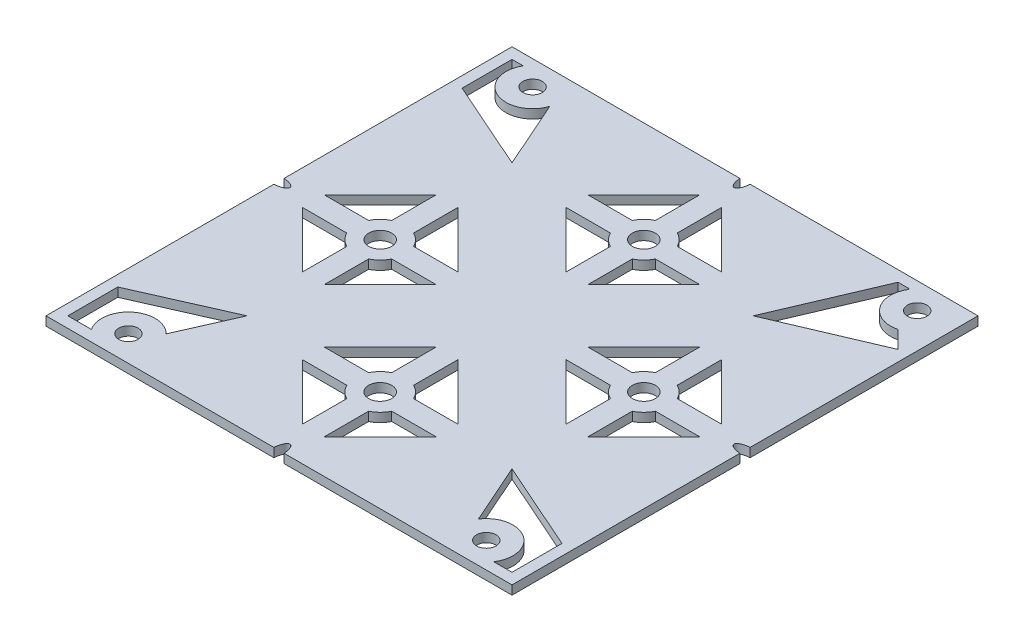
from build123d import *

# Parameters (mm, degrees)
SKETCH1_W           = 97.6
SKETCH1_H           = 97.6
BOSS_EXTRUDE1_DEPTH = 1.85
SKETCH3_R           = 1.25
CUT_EXTRUDE1_DEPTH  = 10
FILLET1_R           = 0.2
SKETCH5_R           = 2.375
CUT_EXTRUDE2_DEPTH  = 10
SKETCH6_R           = 2
CUT_EXTRUDE3_DEPTH  = 139.039641188
SKETCH7_W           = 97.6
SKETCH7_H           = 1.85
CUT_EXTRUDE4_DEPTH  = 0.75
SKETCH8_W           = 96.85
SKETCH8_H           = 1.85
CUT_EXTRUDE5_DEPTH  = 0.75
SKETCH9_W           = 96.85
SKETCH9_H           = 1.85
CUT_EXTRUDE6_DEPTH  = 0.75
SKETCH12_W          = 96.1
SKETCH12_H          = 1.85
CUT_EXTRUDE7_DEPTH  = 0.75


with BuildPart() as part:
    # Sketch1 → Boss-Extrude1 (new body)
    with BuildSketch(Plane(origin=(0, 0, 0), x_dir=(1, 0, 0), z_dir=(0, 1, 0))):
        with Locations((48.8, 48.8)):
            Rectangle(SKETCH1_W, SKETCH1_H)
    extrude(amount=BOSS_EXTRUDE1_DEPTH)

    # Sketch3 → Cut-Extrude1 (cut)
    with BuildSketch(Plane.XZ):
        with BuildLine():
            Line((3, -84.3), (3, -94.6))
            Line((3, -94.6), (5.316079849, -94.6))
            ThreePointArc((5.316079849, -94.6), (7.792729855, -86.784550719), (15.285000001, -90.113353923))
            Line((15.285000001, -90.113353923), (21.472818771, -76.127181229))
            Line((21.472818771, -76.127181229), (3, -84.3))
        make_face()
        with BuildLine():
            Line((3, -13.3), (21.472818771, -21.472818771))
            Line((21.472818771, -21.472818771), (16.360495139, -9.917560959))
            ThreePointArc((16.360495139, -9.917560959), (8.975209709, -10.313312378), (7.873156109, -3))
            Line((7.873156109, -3), (3, -3))
            Line((3, -3), (3, -13.3))
        make_face()
        with BuildLine():
            Line((94.6, -13.3), (94.6, -3))
            Line((94.6, -3), (90.826843891, -3))
            ThreePointArc((90.826843891, -3), (89.267333256, -10.648445392), (81.630186258, -9.034513526))
            Line((81.630186258, -9.034513526), (76.127181229, -21.472818771))
            Line((76.127181229, -21.472818771), (94.6, -13.3))
        make_face()
        with BuildLine():
            Line((91.027327292, -86.172672708), (94.6, -82.6))
            Line((94.6, -82.6), (73.674141566, -73.674141566))
            Line((73.674141566, -73.674141566), (82.6, -94.6))
            Line((82.6, -94.6), (85.116873323, -94.6))
            ThreePointArc((85.116873323, -94.6), (85.157069093, -88.341897208), (91.027327292, -86.172672708))
        make_face()
        with Locations((89.66, -91.5)):
            Circle(SKETCH3_R)
        with Locations((10.05, -91.8)):
            Circle(SKETCH3_R)
        with Locations((12.45, -6.05)):
            Circle(SKETCH3_R)
        with Locations((86.25, -6.05)):
            Circle(SKETCH3_R)
    extrude(amount=-CUT_EXTRUDE1_DEPTH, mode=Mode.SUBTRACT)

    # Fillet1
    fillet1_edges = [part.edges().sort_by_distance(p)[0] for p in [
        (85.116873323, 0.925, -94.6),
    ]]
    fillet(fillet1_edges, radius=FILLET1_R)

    # Sketch5 → Cut-Extrude2 (cut)
    with BuildSketch(Plane.XZ):
        with BuildLine():
            Line((51.05, -80.617052601), (51.05, -89.767052601))
            Line((51.05, -89.767052601), (62.582493929, -78.234558673))
            Line((62.582493929, -78.234558673), (53.432493929, -78.234558673))
            ThreePointArc((53.432493929, -78.234558673), (52.441599923, -79.626158596), (51.05, -80.617052601))
        make_face()
        with BuildLine():
            Line((46.55, -89.767052601), (46.55, -80.617052601))
            ThreePointArc((46.55, -80.617052601), (45.158400077, -79.626158596), (44.167506071, -78.234558673))
            Line((44.167506071, -78.234558673), (35.017506071, -78.234558673))
            Line((35.017506071, -78.234558673), (46.55, -89.767052601))
        make_face()
        with BuildLine():
            Line((35.017506071, -73.734558673), (44.167506071, -73.734558673))
            ThreePointArc((44.167506071, -73.734558673), (45.158400077, -72.34295875), (46.55, -71.352064744))
            Line((46.55, -71.352064744), (46.55, -62.202064744))
            Line((46.55, -62.202064744), (35.017506071, -73.734558673))
        make_face()
        with BuildLine():
            ThreePointArc((51.05, -71.352064744), (52.441599923, -72.34295875), (53.432493929, -73.734558673))
            Line((53.432493929, -73.734558673), (62.582493929, -73.734558673))
            Line((62.582493929, -73.734558673), (51.05, -62.202064744))
            Line((51.05, -62.202064744), (51.05, -71.352064744))
        make_face()
        with BuildLine():
            Line((73.734558673, -35.017506071), (62.202064744, -46.55))
            Line((62.202064744, -46.55), (71.352064744, -46.55))
            ThreePointArc((71.352064744, -46.55), (72.34295875, -45.158400077), (73.734558673, -44.167506071))
            Line((73.734558673, -44.167506071), (73.734558673, -35.017506071))
        make_face()
        with BuildLine():
            ThreePointArc((73.734558673, -53.432493929), (72.34295875, -52.441599923), (71.352064744, -51.05))
            Line((71.352064744, -51.05), (62.202064744, -51.05))
            Line((62.202064744, -51.05), (73.734558673, -62.582493929))
            Line((73.734558673, -62.582493929), (73.734558673, -53.432493929))
        make_face()
        with BuildLine():
            Line((78.234558673, -35.017506071), (78.234558673, -44.167506071))
            ThreePointArc((78.234558673, -44.167506071), (79.626158596, -45.158400077), (80.617052601, -46.55))
            Line((80.617052601, -46.55), (89.767052601, -46.55))
            Line((89.767052601, -46.55), (78.234558673, -35.017506071))
        make_face()
        with BuildLine():
            ThreePointArc((80.617052601, -51.05), (79.626158596, -52.441599923), (78.234558673, -53.432493929))
            Line((78.234558673, -53.432493929), (78.234558673, -62.582493929))
            Line((78.234558673, -62.582493929), (89.767052601, -51.05))
            Line((89.767052601, -51.05), (80.617052601, -51.05))
        make_face()
        with BuildLine():
            Line((46.55, -16.982947399), (46.55, -7.832947399))
            Line((46.55, -7.832947399), (35.017506071, -19.365441327))
            Line((35.017506071, -19.365441327), (44.167506071, -19.365441327))
            ThreePointArc((44.167506071, -19.365441327), (45.158400077, -17.973841404), (46.55, -16.982947399))
        make_face()
        with BuildLine():
            Line((51.05, -7.832947399), (51.05, -16.982947399))
            ThreePointArc((51.05, -16.982947399), (52.441599923, -17.973841404), (53.432493929, -19.365441327))
            Line((53.432493929, -19.365441327), (62.582493929, -19.365441327))
            Line((62.582493929, -19.365441327), (51.05, -7.832947399))
        make_face()
        with BuildLine():
            ThreePointArc((46.55, -26.247935256), (45.158400077, -25.25704125), (44.167506071, -23.865441327))
            Line((44.167506071, -23.865441327), (35.017506071, -23.865441327))
            Line((35.017506071, -23.865441327), (46.55, -35.397935256))
            Line((46.55, -35.397935256), (46.55, -26.247935256))
        make_face()
        with BuildLine():
            Line((62.582493929, -23.865441327), (53.432493929, -23.865441327))
            ThreePointArc((53.432493929, -23.865441327), (52.441599923, -25.25704125), (51.05, -26.247935256))
            Line((51.05, -26.247935256), (51.05, -35.397935256))
            Line((51.05, -35.397935256), (62.582493929, -23.865441327))
        make_face()
        with BuildLine():
            Line((23.865441327, -62.582493929), (35.397935256, -51.05))
            Line((35.397935256, -51.05), (26.247935256, -51.05))
            ThreePointArc((26.247935256, -51.05), (25.25704125, -52.441599923), (23.865441327, -53.432493929))
            Line((23.865441327, -53.432493929), (23.865441327, -62.582493929))
        make_face()
        with BuildLine():
            Line((19.365441327, -62.582493929), (19.365441327, -53.432493929))
            ThreePointArc((19.365441327, -53.432493929), (17.973841404, -52.441599923), (16.982947399, -51.05))
            Line((16.982947399, -51.05), (7.832947399, -51.05))
            Line((7.832947399, -51.05), (19.365441327, -62.582493929))
        make_face()
        with BuildLine():
            ThreePointArc((23.865441327, -44.167506071), (25.25704125, -45.158400077), (26.247935256, -46.55))
            Line((26.247935256, -46.55), (35.397935256, -46.55))
            Line((35.397935256, -46.55), (23.865441327, -35.017506071))
            Line((23.865441327, -35.017506071), (23.865441327, -44.167506071))
        make_face()
        with BuildLine():
            Line((7.832947399, -46.55), (16.982947399, -46.55))
            ThreePointArc((16.982947399, -46.55), (17.973841404, -45.158400077), (19.365441327, -44.167506071))
            Line((19.365441327, -44.167506071), (19.365441327, -35.017506071))
            Line((19.365441327, -35.017506071), (7.832947399, -46.55))
        make_face()
        with BuildLine():
            Line((47.7, -97.6), (49.9, -97.6))
            add(Edge.make_bspline(
                [(49.9, -97.6), (49.9, -94.604595373), (48.8, -94.604595373)],
                knots=[4.71238898, 4.71238898, 4.71238898, 6.283185307, 6.283185307, 6.283185307], degree=2, weights=[1, 0.707106781, 1]))
            add(Edge.make_bspline(
                [(48.8, -94.604595373), (47.7, -94.604595373), (47.7, -97.6)],
                knots=[0, 0, 0, 1.570796327, 1.570796327, 1.570796327], degree=2, weights=[1, 0.707106781, 1]))
        make_face()
        with BuildLine():
            add(Edge.make_bspline(
                [(94.596161078, -48.8), (94.596161078, -49.9), (97.6, -49.9)],
                knots=[0, 0, 0, 1.570796327, 1.570796327, 1.570796327], degree=2, weights=[1, 0.707106781, 1]))
            Line((97.6, -49.9), (97.6, -47.7))
            add(Edge.make_bspline(
                [(97.6, -47.7), (94.596161078, -47.7), (94.596161078, -48.8)],
                knots=[4.71238898, 4.71238898, 4.71238898, 6.283185307, 6.283185307, 6.283185307], degree=2, weights=[1, 0.707106781, 1]))
        make_face()
        with BuildLine():
            Line((0, -47.7), (0, -49.9))
            add(Edge.make_bspline(
                [(0, -49.9), (3, -49.9), (3, -48.8)],
                knots=[4.71238898, 4.71238898, 4.71238898, 6.283185307, 6.283185307, 6.283185307], degree=2, weights=[1, 0.707106781, 1]))
            add(Edge.make_bspline(
                [(3, -48.8), (3, -47.7), (0, -47.7)],
                knots=[0, 0, 0, 1.570796327, 1.570796327, 1.570796327], degree=2, weights=[1, 0.707106781, 1]))
        make_face()
        with BuildLine():
            add(Edge.make_bspline(
                [(48.8, -3), (49.9, -3), (49.9, 0)],
                knots=[0, 0, 0, 1.570796327, 1.570796327, 1.570796327], degree=2, weights=[1, 0.707106781, 1]))
            Line((49.9, 0), (47.7, 0))
            add(Edge.make_bspline(
                [(47.7, 0), (47.7, -3), (48.8, -3)],
                knots=[4.71238898, 4.71238898, 4.71238898, 6.283185307, 6.283185307, 6.283185307], degree=2, weights=[1, 0.707106781, 1]))
        make_face()
        with Locations((48.8, -75.984558673)):
            Circle(SKETCH5_R)
        with Locations((75.984558673, -48.8)):
            Circle(SKETCH5_R)
        with Locations((48.8, -21.615441327)):
            Circle(SKETCH5_R)
        with Locations((21.615441327, -48.8)):
            Circle(SKETCH5_R)
    extrude(amount=-CUT_EXTRUDE2_DEPTH, mode=Mode.SUBTRACT)

    # Sketch6 → Cut-Extrude3 (cut, through all)
    with BuildSketch(Plane.XZ):
        with Locations((12.45, -6.05)):
            Circle(SKETCH6_R)
        with Locations((86.25, -6.05)):
            Circle(SKETCH6_R)
        with Locations((10.05, -91.8)):
            Circle(SKETCH6_R)
        with Locations((89.66, -91.5)):
            Circle(SKETCH6_R)
    extrude(amount=-CUT_EXTRUDE3_DEPTH, mode=Mode.SUBTRACT)

    # Sketch7 → Cut-Extrude4 (cut)
    with BuildSketch(Plane(origin=(0, 0, -97.6), x_dir=(-1, 0, 0), z_dir=(0, 0, -1))):
        with Locations((-48.8, 0.925)):
            Rectangle(SKETCH7_W, SKETCH7_H)
    extrude(amount=-CUT_EXTRUDE4_DEPTH, mode=Mode.SUBTRACT)

    # Sketch8 → Cut-Extrude5 (cut)
    with BuildSketch(Plane(origin=(97.6, 0, 0), x_dir=(0, 0, -1), z_dir=(1, 0, 0))):
        with Locations((48.425, 0.925)):
            Rectangle(SKETCH8_W, SKETCH8_H)
    extrude(amount=-CUT_EXTRUDE5_DEPTH, mode=Mode.SUBTRACT)

    # Sketch9 → Cut-Extrude6 (cut)
    with BuildSketch(Plane.XY):
        with Locations((48.425, 0.925)):
            Rectangle(SKETCH9_W, SKETCH9_H)
    extrude(amount=-CUT_EXTRUDE6_DEPTH, mode=Mode.SUBTRACT)

    # Sketch12 → Cut-Extrude7 (cut)
    with BuildSketch(Plane.ZY):
        with Locations((-48.8, 0.925)):
            Rectangle(SKETCH12_W, SKETCH12_H)
    extrude(amount=-CUT_EXTRUDE7_DEPTH, mode=Mode.SUBTRACT)


solid = part.part
